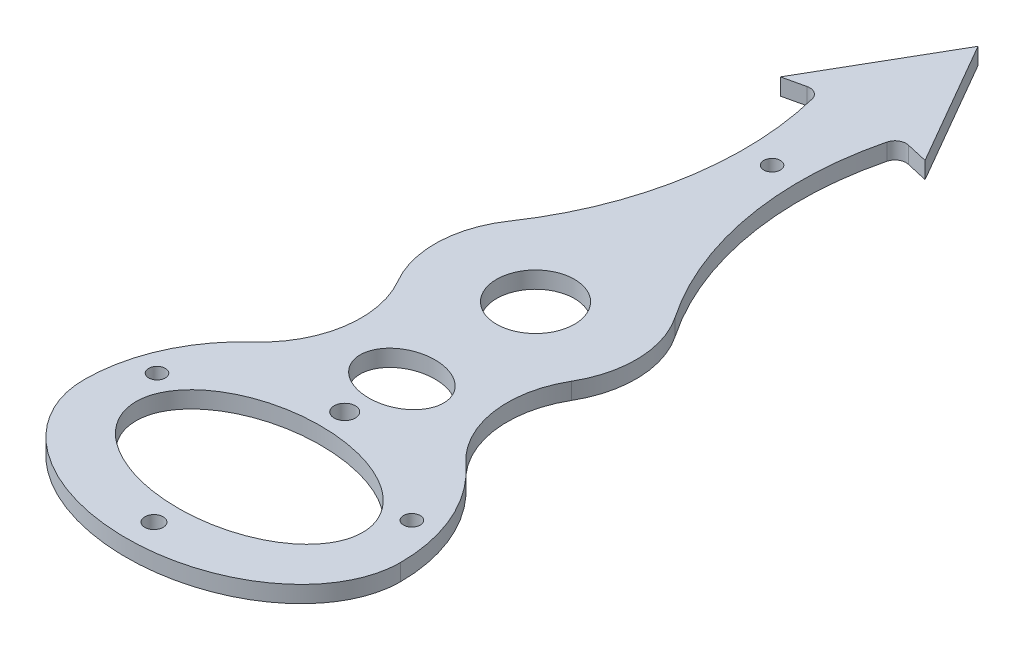
from build123d import *

# Parameters (mm, degrees)
SKETCH1_R           = 1.65
SKETCH1_R_2         = 1.5
SKETCH1_R_3         = 7
SKETCH1_R_4         = 1.909188309
BOSS_EXTRUDE1_DEPTH = 3
SKETCH2_RX          = 20.362751378
SKETCH2_RY          = 12.812950259
SKETCH2_RX_2        = 7.5
SKETCH2_RY_2        = 5.944828068
CUT_EXTRUDE1_DEPTH  = 85.488395158


with BuildPart() as part:
    # Sketch1 → Boss-Extrude1 (new body)
    with BuildSketch(Plane(origin=(0, 0, 0), x_dir=(1, 0, 0), z_dir=(0, 1, 0))):
        with BuildLine():
            Line((-12.992809169, 56.995794387), (0, 79.5))
            Line((0, 79.5), (12.992809169, 56.995794387))
            Line((12.992809169, 56.995794387), (9.092858534, 57.88483041))
            ThreePointArc((9.092858534, 57.88483041), (7.600788158, 57.638566935), (6.707634818, 56.418240413))
            ThreePointArc((6.707634818, 56.418240413), (5.891310086, 32.40341367), (14.944034973, 10.145236258))
            ThreePointArc((14.944034973, 10.145236258), (18.051873862, 0.616319792), (15.601179111, -9.102373886))
            ThreePointArc((15.601179111, -9.102373886), (13.352587893, -20.968024673), (19.083723838, -31.598354482))
            ThreePointArc((19.083723838, -31.598354482), (25.998546823, -41.152307046), (28.443609023, -52.689830928))
            add(Edge.make_bspline(
                [(-28.443609023, -52.689830928), (-28.443609023, -73.556390977), (0, -73.556390977), (28.443609023, -73.556390977), (28.443609023, -52.689830928)],
                knots=[0, 0, 0, 1.570796327, 1.570796327, 3.141592654, 3.141592654, 3.141592654], degree=2, weights=[1, 0.707106781, 1, 0.707106781, 1]))
            ThreePointArc((-28.443609023, -52.689830928), (-25.998546823, -41.152307046), (-19.083723838, -31.598354482))
            ThreePointArc((-19.083723838, -31.598354482), (-13.352587893, -20.968024673), (-15.601179111, -9.102373886))
            ThreePointArc((-15.601179111, -9.102373886), (-18.051873862, 0.616319792), (-14.944034973, 10.145236258))
            ThreePointArc((-14.944034973, 10.145236258), (-5.891310086, 32.40341367), (-6.707634818, 56.418240413))
            ThreePointArc((-6.707634818, 56.418240413), (-7.600788158, 57.638566935), (-9.092858534, 57.88483041))
            Line((-9.092858534, 57.88483041), (-12.992809169, 56.995794387))
        make_face()
        with Locations((0, -68.556390977)):
            Circle(SKETCH1_R, mode=Mode.SUBTRACT)
        with Locations((-22.896149501, -45.11234526)):
            Circle(SKETCH1_R_2, mode=Mode.SUBTRACT)
        with Locations((22.896149501, -45.11234526)):
            Circle(SKETCH1_R_2, mode=Mode.SUBTRACT)
        Circle(SKETCH1_R_3, mode=Mode.SUBTRACT)
        with Locations((0, 42.497076519)):
            Circle(SKETCH1_R_2, mode=Mode.SUBTRACT)
        with Locations((0, -34.278195489)):
            Circle(SKETCH1_R_4, mode=Mode.SUBTRACT)
    extrude(amount=BOSS_EXTRUDE1_DEPTH)

    # Sketch2 → Cut-Extrude1 (cut, through all)
    with BuildSketch(Plane(origin=(0, 3, 0), x_dir=(1, 0, 0), z_dir=(0, 1, 0))):
        with Locations((0, -51.417293233)):
            Ellipse(SKETCH2_RX, SKETCH2_RY)
        with Locations(Location((0, -24.007219936), (0, 0, -180))):
            Ellipse(SKETCH2_RX_2, SKETCH2_RY_2)
    extrude(amount=-CUT_EXTRUDE1_DEPTH, mode=Mode.SUBTRACT)


solid = part.part
